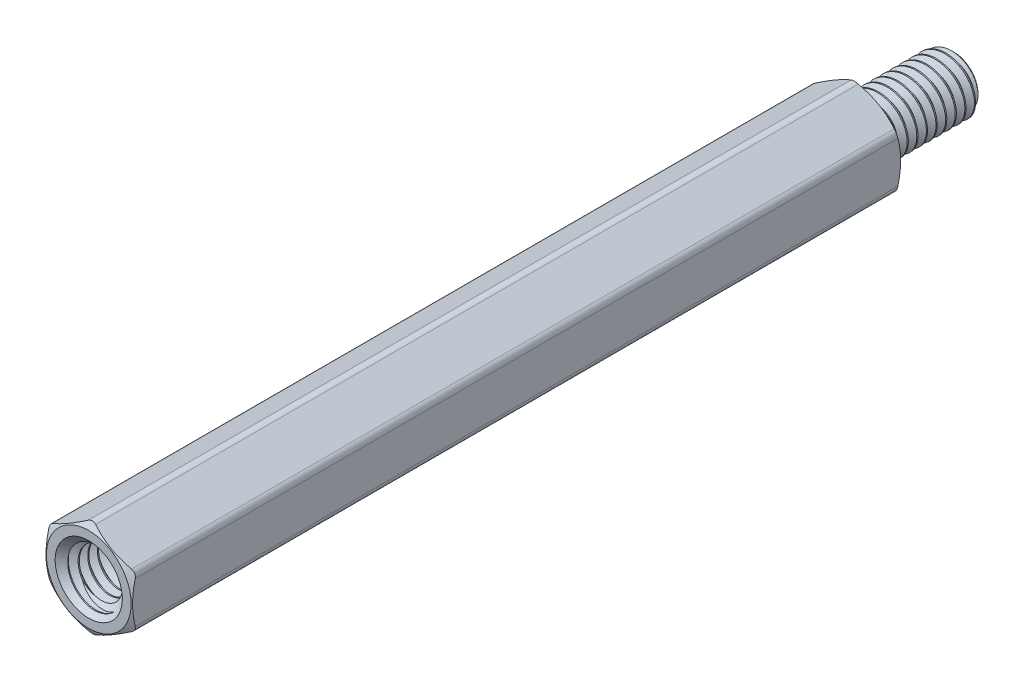
from build123d import *

# Parameters (mm, degrees)
SKETCH4_R           = 1.875
BOSS_EXTRUDE1_DEPTH = 40
SKETCH5_OUTSIDE_W   = 175.408
SKETCH5_OUTSIDE_H   = 176.104
SKETCH5_OUTSIDE_R   = 2.205
CUT_EXTRUDE1_DEPTH  = 46.13105915
CUT_EXTRUDE1_DRAFT  = -60
SKETCH6_OUTSIDE_W   = 158.144
SKETCH6_OUTSIDE_H   = 158.84
SKETCH6_OUTSIDE_R   = 2.205
CUT_EXTRUDE2_DEPTH  = 41.147384722
CUT_EXTRUDE2_DRAFT  = -60
FILLET1_R           = 0.3825
CUT_SWEEP1_PITCH    = 0.5
SKETCH9_R           = 1.75
BOSS_EXTRUDE2_DEPTH = 6.4
SKETCH10_W          = 6.4
SKETCH10_H          = 1.5
CUT_SWEEP2_PITCH    = 0.5


with BuildPart() as part:
    # Sketch3 → Revolve1 (revolve)
    with BuildSketch(Plane(origin=(0, 0, 0), x_dir=(0, 0, -1), z_dir=(1, 0, 0))):
        with BuildLine():
            Line((-33.6, 1.25), (-33.6, 0))
            Line((-33.6, 0), (5, 0))
            Line((5, 0), (5, 1.25))
            Line((5, 1.25), (4.75, 1.5))
            Line((4.75, 1.5), (0.7875, 1.5))
            Line((0.7875, 1.5), (0.6, 1.175240474))
            Line((0.6, 1.175240474), (0.25, 1.175240474))
            ThreePointArc((0.25, 1.175240474), (0.073223305, 1.248463778), (0, 1.425240474))
            Line((0, 1.425240474), (0, 2.25))
            Line((0, 2.25), (-40, 2.25))
            Line((-40, 2.25), (-40, 1.75))
            Line((-40, 1.75), (-39.75, 1.5))
            Line((-39.75, 1.5), (-33.85, 1.5))
            Line((-33.85, 1.5), (-33.6, 1.25))
        make_face()
    revolve(axis=Axis((0, 0, -5), (0, 0, 1)))

    # Sketch4 → Boss-Extrude1 (add)
    with BuildSketch(Plane.XY.offset(40)):
        Polygon((-2.25, 1.299038106), (-2.25, -1.299038106), (0, -2.598076211), (2.25, -1.299038106), (2.25, 1.299038106), (0, 2.598076211), align=None)
        Circle(SKETCH4_R, mode=Mode.SUBTRACT)
    extrude(amount=-BOSS_EXTRUDE1_DEPTH)


with BuildPart() as cut_extrude1_tool:
    # Sketch5 outside → Cut-Extrude1 (with draft: the straight prism first)
    with BuildSketch(Plane.XY.offset(40)):
        Rectangle(SKETCH5_OUTSIDE_W, SKETCH5_OUTSIDE_H)
        Circle(SKETCH5_OUTSIDE_R, mode=Mode.SUBTRACT)
    extrude(amount=-CUT_EXTRUDE1_DEPTH)
    # Cut-Extrude1: the draft: its side faces are tilted about the plane it starts from
    cut_extrude1_sides = [cut_extrude1_tool.faces().sort_by_distance(p)[0] for p in [
        (0, -88.052, 16.934470425),
        (87.704, 0, 16.934470425),
        (0, 88.052, 16.934470425),
        (-87.704, 0, 16.934470425),
        (-2.205, 0, 16.934470425),
    ]]
    draft(cut_extrude1_sides, Plane.XY.offset(40), CUT_EXTRUDE1_DRAFT)


with BuildPart() as part_1:
    add(part.part)

    # Cut-Extrude1: cut by cut_extrude1_tool
    add(cut_extrude1_tool.part, mode=Mode.SUBTRACT)


with BuildPart() as cut_extrude2_tool:
    # Sketch6 outside → Cut-Extrude2 (with draft: the straight prism first)
    with BuildSketch(Plane(origin=(0, 0, 0), x_dir=(-1, 0, 0), z_dir=(0, 0, -1))):
        Rectangle(SKETCH6_OUTSIDE_W, SKETCH6_OUTSIDE_H)
        Circle(SKETCH6_OUTSIDE_R, mode=Mode.SUBTRACT)
    extrude(amount=-CUT_EXTRUDE2_DEPTH)
    # Cut-Extrude2: the draft: its side faces are tilted about the plane it starts from
    cut_extrude2_sides = [cut_extrude2_tool.faces().sort_by_distance(p)[0] for p in [
        (0, -79.42, 20.573692361),
        (-79.072, 0, 20.573692361),
        (0, 79.42, 20.573692361),
        (79.072, 0, 20.573692361),
        (2.205, 0, 20.573692361),
    ]]
    draft(cut_extrude2_sides, Plane(origin=(0, 0, 0), x_dir=(-1, 0, 0), z_dir=(0, 0, -1)), CUT_EXTRUDE2_DRAFT)


with BuildPart() as part_2:
    add(part_1.part)

    # Cut-Extrude2: cut by cut_extrude2_tool
    add(cut_extrude2_tool.part, mode=Mode.SUBTRACT)

    # Fillet1
    fillet1_edges = [part_2.edges().sort_by_distance(p)[0] for p in [
        (0, 2.598076211, 20),
        (-2.25, -1.299038106, 20),
        (0, -2.598076211, 20),
        (2.25, -1.299038106, 20),
        (2.25, 1.299038106, 20),
        (-2.25, 1.299038106, 20),
    ]]
    fillet(fillet1_edges, radius=FILLET1_R)

    # Cut-Sweep1: the profile of Sketch7 profile screwed along a right-hand helix of 9.7 turns, 6 arcs to a turn; built about Z, then put on its axis
    cut_sweep1_z = Axis((0, 0, 0), (0, 0, 1))
    cut_sweep1_corners = [(1.174940474, 0, -0.187673205), (1.174940474, 0, -0.249826795), (1.527063294, 0, -0.453125), (1.527063294, 0, 0.015625)]
    with BuildLine(mode=Mode.PRIVATE) as cut_sweep1_profile:
        Line(cut_sweep1_corners[0], cut_sweep1_corners[1])
        Line(cut_sweep1_corners[1], cut_sweep1_corners[2])
        Line(cut_sweep1_corners[2], cut_sweep1_corners[3])
        Line(cut_sweep1_corners[3], cut_sweep1_corners[0])
    cut_sweep1_cap = Face(cut_sweep1_profile.wire())
    cut_sweep1_turn_angles = [0, 30, 60, 90, 120, 150, 180, 210, 240, 270, 300, 330, 360]
    cut_sweep1_turn_weights = [1, 0.8660254037844387, 1, 0.8660254037844387, 1, 0.8660254037844387, 1, 0.8660254037844387, 1, 0.8660254037844387, 1, 0.8660254037844387, 1]
    cut_sweep1_turn_rails = [Edge.make_bspline([Vector(p[0], p[1], 0).rotate(cut_sweep1_z, cut_sweep1_turn_angles[k]) / cut_sweep1_turn_weights[k] + Vector(0, 0, p[2] + CUT_SWEEP1_PITCH * cut_sweep1_turn_angles[k] / 360) for k in range(13)], [0, 0, 0, 1, 1, 2, 2, 3, 3, 4, 4, 5, 5, 6, 6, 6], 2, cut_sweep1_turn_weights) for p in cut_sweep1_corners]
    cut_sweep1_turn_sides = [Face.make_surface_from_curves(cut_sweep1_turn_rails[p[0]], cut_sweep1_turn_rails[p[1]]) for p in [(0, 1), (1, 2), (2, 3), (3, 0)]]
    cut_sweep1_last_angles = [3240, 3270, 3300, 3330, 3360, 3390, 3420, 3450, 3480, 3486, 3492]
    cut_sweep1_last_weights = [1, 0.8660254037844387, 1, 0.8660254037844387, 1, 0.8660254037844387, 1, 0.8660254037844387, 1, 0.9945218953682634, 1]
    cut_sweep1_last_rails = [Edge.make_bspline([Vector(p[0], p[1], 0).rotate(cut_sweep1_z, cut_sweep1_last_angles[k]) / cut_sweep1_last_weights[k] + Vector(0, 0, p[2] + CUT_SWEEP1_PITCH * cut_sweep1_last_angles[k] / 360) for k in range(11)], [0, 0, 0, 1, 1, 2, 2, 3, 3, 4, 4, 5, 5, 5], 2, cut_sweep1_last_weights) for p in cut_sweep1_corners]
    cut_sweep1_last_sides = [Face.make_surface_from_curves(cut_sweep1_last_rails[p[0]], cut_sweep1_last_rails[p[1]]) for p in [(0, 1), (1, 2), (2, 3), (3, 0)]]
    cut_sweep1 = Plane(origin=(0, 0, -5), x_dir=(0, 1, 0), z_dir=(0, 0, 1)) * Solid(Shell([*[p.moved(Location((0, 0, CUT_SWEEP1_PITCH * i))) for i in range(9) for p in cut_sweep1_turn_sides], *cut_sweep1_last_sides, cut_sweep1_cap, cut_sweep1_cap.rotate(cut_sweep1_z, 3492).moved(Location((0, 0, CUT_SWEEP1_PITCH * 3492 / 360)))]))
    add(cut_sweep1, mode=Mode.SUBTRACT)

    # Sketch9 → Boss-Extrude2 (add)
    with BuildSketch(Plane.XY.offset(33.6)):
        Circle(SKETCH9_R)
    extrude(amount=BOSS_EXTRUDE2_DEPTH)


with BuildPart() as body_2:
    # Sketch10 → Revolve2 (revolve)
    with BuildSketch(Plane(origin=(0, 0, 0), x_dir=(0, 0, -1), z_dir=(1, 0, 0))):
        with Locations((-36.8, 0.75)):
            Rectangle(SKETCH10_W, SKETCH10_H)
    revolve(axis=Axis((0, 0, -5), (0, 0, 1)))

    # Cut-Sweep2: the profile of Sketch12 profile screwed along a right-hand helix of 13.8 turns, 6 arcs to a turn; built about Z, then put on its axis
    cut_sweep2_z = Axis((0, 0, 0), (0, 0, 1))
    cut_sweep2_corners = [(1.174940474, 0, -0.249826795), (1.174940474, 0, -0.187673205), (1.527063294, 0, 0.015625), (1.527063294, 0, -0.453125)]
    with BuildLine(mode=Mode.PRIVATE) as cut_sweep2_profile:
        Line(cut_sweep2_corners[0], cut_sweep2_corners[1])
        Line(cut_sweep2_corners[1], cut_sweep2_corners[2])
        Line(cut_sweep2_corners[2], cut_sweep2_corners[3])
        Line(cut_sweep2_corners[3], cut_sweep2_corners[0])
    cut_sweep2_cap = Face(cut_sweep2_profile.wire())
    cut_sweep2_turn_angles = [0, 30, 60, 90, 120, 150, 180, 210, 240, 270, 300, 330, 360]
    cut_sweep2_turn_weights = [1, 0.8660254037844387, 1, 0.8660254037844387, 1, 0.8660254037844387, 1, 0.8660254037844387, 1, 0.8660254037844387, 1, 0.8660254037844387, 1]
    cut_sweep2_turn_rails = [Edge.make_bspline([Vector(p[0], p[1], 0).rotate(cut_sweep2_z, cut_sweep2_turn_angles[k]) / cut_sweep2_turn_weights[k] + Vector(0, 0, p[2] + CUT_SWEEP2_PITCH * cut_sweep2_turn_angles[k] / 360) for k in range(13)], [0, 0, 0, 1, 1, 2, 2, 3, 3, 4, 4, 5, 5, 6, 6, 6], 2, cut_sweep2_turn_weights) for p in cut_sweep2_corners]
    cut_sweep2_turn_sides = [Face.make_surface_from_curves(cut_sweep2_turn_rails[p[0]], cut_sweep2_turn_rails[p[1]]) for p in [(0, 1), (1, 2), (2, 3), (3, 0)]]
    cut_sweep2_last_angles = [4680, 4710, 4740, 4770, 4800, 4830, 4860, 4890, 4920, 4944, 4968]
    cut_sweep2_last_weights = [1, 0.8660254037844387, 1, 0.8660254037844387, 1, 0.8660254037844387, 1, 0.8660254037844387, 1, 0.9135454576426139, 1]
    cut_sweep2_last_rails = [Edge.make_bspline([Vector(p[0], p[1], 0).rotate(cut_sweep2_z, cut_sweep2_last_angles[k]) / cut_sweep2_last_weights[k] + Vector(0, 0, p[2] + CUT_SWEEP2_PITCH * cut_sweep2_last_angles[k] / 360) for k in range(11)], [0, 0, 0, 1, 1, 2, 2, 3, 3, 4, 4, 5, 5, 5], 2, cut_sweep2_last_weights) for p in cut_sweep2_corners]
    cut_sweep2_last_sides = [Face.make_surface_from_curves(cut_sweep2_last_rails[p[0]], cut_sweep2_last_rails[p[1]]) for p in [(0, 1), (1, 2), (2, 3), (3, 0)]]
    cut_sweep2 = Plane(origin=(0, 0, 40), x_dir=(0, 1, 0), z_dir=(0, 0, -1)) * Solid(Shell([*[p.moved(Location((0, 0, CUT_SWEEP2_PITCH * i))) for i in range(13) for p in cut_sweep2_turn_sides], *cut_sweep2_last_sides, cut_sweep2_cap, cut_sweep2_cap.rotate(cut_sweep2_z, 4968).moved(Location((0, 0, CUT_SWEEP2_PITCH * 4968 / 360)))]))
    add(cut_sweep2, mode=Mode.SUBTRACT)


with BuildPart() as part_3:
    add(part_2.part)

    # Combine1: cut body 2
    add(body_2.part, mode=Mode.SUBTRACT)

    # Cut-Extrude3 cone 1 section (through the dimple's axis) → Cut-Extrude3 (revolve, cut)
    with BuildSketch(Plane(origin=(0, 0, 40), x_dir=(0, -1, 0), z_dir=(1, 0, 0))):
        Polygon((0, 0), (1.7475, 0), (0, 1.7475), align=None)
    revolve(axis=Axis((0, 0, 40), (0, 0, -1)), mode=Mode.SUBTRACT)


solid = part_3.part
